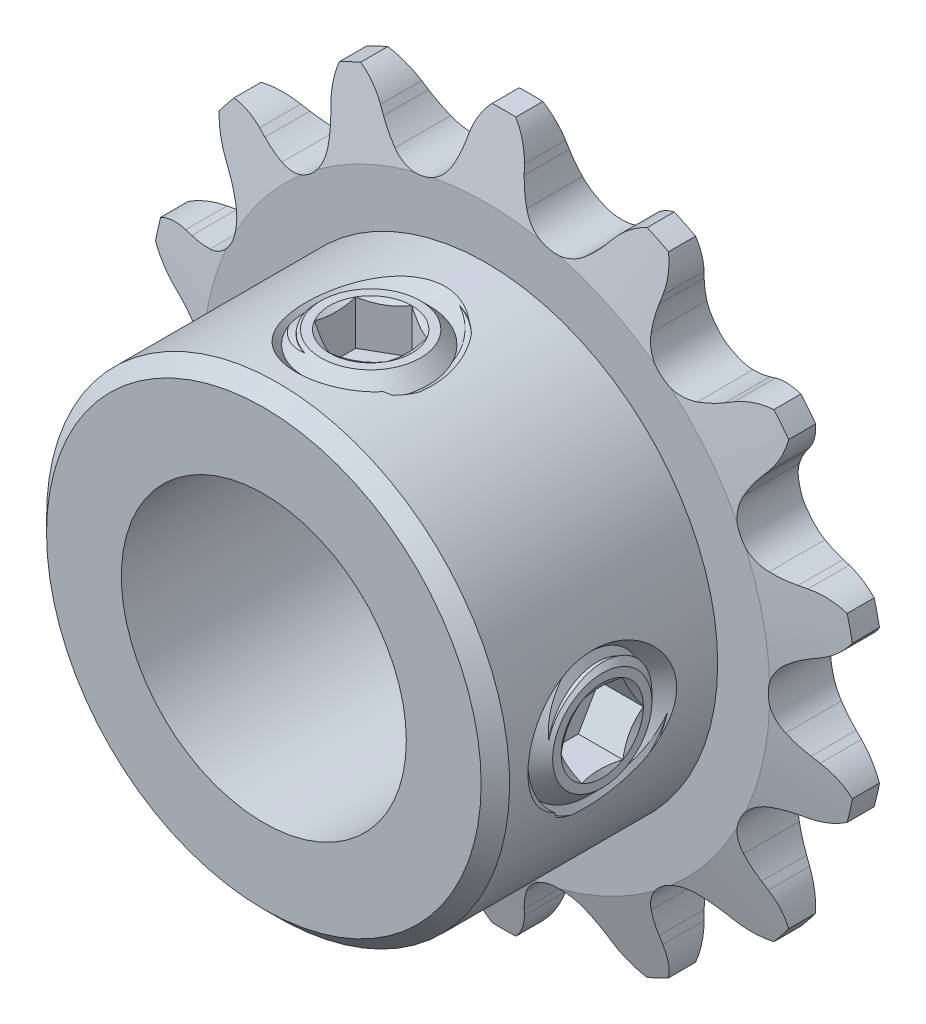
from build123d import *

# Parameters (mm, degrees)
CUT_EXTRUDE1_DEPTH      = 23.410198508
CIRPATTERN1_COUNT       = 14
BOSS_EXTRUDE1_START     = 1.397
SKETCH2_R               = 10.31875
BOSS_EXTRUDE1_DEPTH     = 9.906
CUT_EXTRUDE2_DEPTH      = 25.879893202
CUT_EXTRUDE2_DEPTH_BACK = 25.879893202
SKETCH3_OUTSIDE_W       = 42.278
SKETCH3_OUTSIDE_H       = 42.854
SKETCH3_OUTSIDE_R       = 15.875
SKETCH3_OUTSIDE_R_2     = 6.35
SKETCH4_W               = 1.74625
SKETCH4_H               = 5.461
CUT_EXTRUDE4_REACH      = 34.433
CUT_EXTRUDE4_END_RADIUS = 6.35
SKETCH6_R               = 2.38125
CUT_SWEEP1_PITCH        = 1.27
CIRPATTERN2_COUNT       = 2
CIRPATTERN2_ANGLE       = 90
CUT_SWEEP2_PITCH        = 1.27
CUT_EXTRUDE6_DEPTH      = 1.984375
CIRPATTERN3_COUNT       = 2
CIRPATTERN3_ANGLE       = 90


with BuildPart() as part:
    # Sketch1 → Revolve1 (revolve)
    with BuildSketch(Plane(origin=(0, 0, 0), x_dir=(0, 0, -1), z_dir=(1, 0, 0)), mode=Mode.PRIVATE) as revolve1_sk:
        Polygon((1.397, 0), (-1.397, 0), (-1.397, 12.640583899), (-0.60325, 15.815583899), (0.60325, 15.815583899), (1.397, 12.640583899), align=None)
    revolve(revolve1_sk.sketch.rotate(Axis((0, 0, -1.397), (0, 0, 1)), 90), axis=Axis((0, 0, -1.397), (0, 0, 1)))

    # Sketch0 → Cut-Extrude1 (cut, symmetric)
    with BuildSketch(Plane.XY):
        with BuildLine():
            Line((5.186129219, -13.596278832), (4.966335914, -13.31639744))
            ThreePointArc((4.966335914, -13.31639744), (4.614309016, -12.92049686), (4.216657928, -12.570448549))
            ThreePointArc((4.216657928, -12.570448549), (2.79730298, -12.255785133), (1.655035699, -13.155122107))
            ThreePointArc((1.655035699, -13.155122107), (1.448644719, -13.643039078), (1.303254266, -14.152471922))
            Line((1.303254266, -14.152471922), (1.226663327, -14.500001084))
            ThreePointArc((1.226663327, -14.500001084), (0.154762783, -16.131385383), (-1.73130393, -16.634513455))
            ThreePointArc((-1.73130393, -16.634513455), (3.721521762, -16.305052191), (8.777295839, -14.235994133))
            ThreePointArc((8.777295839, -14.235994133), (6.859709357, -14.601025081), (5.186129219, -13.596278832))
        make_face()
    cut_extrude1 = extrude(amount=CUT_EXTRUDE1_DEPTH, both=True, mode=Mode.SUBTRACT)

    # CirPattern1: Cut-Extrude1 ×14 about axis
    cirpattern1_axis = Axis((0, 0, 0), (0, 0, 1))
    for i in range(1, CIRPATTERN1_COUNT):
        add(cut_extrude1.rotate(cirpattern1_axis, i * 360 / CIRPATTERN1_COUNT), mode=Mode.SUBTRACT)

    # Sketch2 → Boss-Extrude1 (add)
    with BuildSketch(Plane.XY.offset(BOSS_EXTRUDE1_START)):
        Circle(SKETCH2_R)
    extrude(amount=BOSS_EXTRUDE1_DEPTH)

    # Sketch3 outside → Cut-Extrude2 (cut, two sides: drawn at the far end of the back side and taken through both)
    # profile 1 of 2: a face of its own
    with BuildSketch(Plane.XY.offset(-CUT_EXTRUDE2_DEPTH_BACK)):
        Rectangle(SKETCH3_OUTSIDE_W, SKETCH3_OUTSIDE_H)
        Circle(SKETCH3_OUTSIDE_R, mode=Mode.SUBTRACT)
    # profile 2 of 2: a face of its own
    with BuildSketch(Plane.XY.offset(-CUT_EXTRUDE2_DEPTH_BACK)):
        with Locations(Location((0, 0, 0), (0, 0, 180))):
            Circle(SKETCH3_OUTSIDE_R_2)
    extrude(amount=CUT_EXTRUDE2_DEPTH + CUT_EXTRUDE2_DEPTH_BACK, mode=Mode.SUBTRACT)

    # Sketch4 → Cut-Revolve1 (revolve, cut)
    with BuildSketch(Plane(origin=(0, 0, 0), x_dir=(0, 0, -1), z_dir=(1, 0, 0))):
        Polygon((-11.303, 10.31875), (-11.303, 9.68375), (-10.668, 10.31875), align=None)
        with Locations((-2.270125, 13.085083899)):
            Rectangle(SKETCH4_W, SKETCH4_H)
    revolve(axis=Axis((0, 0, -1.397), (0, 0, 1)), mode=Mode.SUBTRACT)

    # Cut-Extrude4: up to this cylinder (the profile starts outside it)
    cut_extrude4_end = Plane(origin=(0, 0, 6.5405), z_dir=(0, 0, -1)) * Cylinder(CUT_EXTRUDE4_END_RADIUS, 82.566, mode=Mode.PRIVATE)
    # Sketch6 → Cut-Extrude4 (cut, up to the surface)
    with BuildSketch(Plane(origin=(0, 10.31875, 0), x_dir=(-1, 0, 0), z_dir=(0, 1, 0)), mode=Mode.PRIVATE) as cut_extrude4_sk1:
        with Locations(Location((0, 6.5405, 0), (0, 0, 90))):
            Circle(SKETCH6_R)
    cut_extrude4_tool1 = extrude(cut_extrude4_sk1.sketch, amount=-CUT_EXTRUDE4_REACH, mode=Mode.PRIVATE) - cut_extrude4_end
    cut_extrude4 = cut_extrude4_tool1.solids().sort_by_distance((0, 10.31875, 6.5405))[0]
    add(cut_extrude4, mode=Mode.SUBTRACT)

    # Cut-Sweep1: arcs per turn and ends read off the stored shape
    # Cut-Sweep1: the profile of Sketch8 screwed along a right-hand helix through 10.125 turns, 8 arcs to a turn; built about Z, then put on its axis
    cut_sweep1_z = Axis((0, 0, 0), (0, 0, 1))
    cut_sweep1_corners = [(3.175, 0, -1.825625), (3.175, 0, -1.984375), (2.281370036, 0, -2.5003125), (2.281370036, 0, -1.3096875)]
    with BuildLine(mode=Mode.PRIVATE) as cut_sweep1_profile:
        Line(cut_sweep1_corners[0], cut_sweep1_corners[1])
        Line(cut_sweep1_corners[1], cut_sweep1_corners[2])
        Line(cut_sweep1_corners[2], cut_sweep1_corners[3])
        Line(cut_sweep1_corners[3], cut_sweep1_corners[0])
    cut_sweep1_cap = Face(cut_sweep1_profile.wire())
    cut_sweep1_turn_angles = [0, 22.5, 45, 67.5, 90, 112.5, 135, 157.5, 180, 202.5, 225, 247.5, 270, 292.5, 315, 337.5, 360]
    cut_sweep1_turn_weights = [1, 0.9238795325112867, 1, 0.9238795325112867, 1, 0.9238795325112867, 1, 0.9238795325112867, 1, 0.9238795325112867, 1, 0.9238795325112867, 1, 0.9238795325112867, 1, 0.9238795325112867, 1]
    cut_sweep1_turn_rails = [Edge.make_bspline([Vector(p[0], p[1], 0).rotate(cut_sweep1_z, cut_sweep1_turn_angles[k]) / cut_sweep1_turn_weights[k] + Vector(0, 0, p[2] + CUT_SWEEP1_PITCH * cut_sweep1_turn_angles[k] / 360) for k in range(17)], [0, 0, 0, 1, 1, 2, 2, 3, 3, 4, 4, 5, 5, 6, 6, 7, 7, 8, 8, 8], 2, cut_sweep1_turn_weights) for p in cut_sweep1_corners]
    cut_sweep1_turn_sides = [Face.make_surface_from_curves(cut_sweep1_turn_rails[p[0]], cut_sweep1_turn_rails[p[1]]) for p in [(0, 1), (1, 2), (2, 3), (3, 0)]]
    cut_sweep1_last_angles = [3600, 3622.5, 3645]
    cut_sweep1_last_weights = [1, 0.9238795325112867, 1]
    cut_sweep1_last_rails = [Edge.make_bspline([Vector(p[0], p[1], 0).rotate(cut_sweep1_z, cut_sweep1_last_angles[k]) / cut_sweep1_last_weights[k] + Vector(0, 0, p[2] + CUT_SWEEP1_PITCH * cut_sweep1_last_angles[k] / 360) for k in range(3)], [0, 0, 0, 1, 1, 1], 2, cut_sweep1_last_weights) for p in cut_sweep1_corners]
    cut_sweep1_last_sides = [Face.make_surface_from_curves(cut_sweep1_last_rails[p[0]], cut_sweep1_last_rails[p[1]]) for p in [(0, 1), (1, 2), (2, 3), (3, 0)]]
    cut_sweep1 = Plane(origin=(0, 10.31875, 6.5405), x_dir=(0, 0, 1), z_dir=(0, -1, 0)) * Solid(Shell([*[p.moved(Location((0, 0, CUT_SWEEP1_PITCH * i))) for i in range(10) for p in cut_sweep1_turn_sides], *cut_sweep1_last_sides, cut_sweep1_cap, cut_sweep1_cap.rotate(cut_sweep1_z, 3645).moved(Location((0, 0, CUT_SWEEP1_PITCH * 3645 / 360)))]))
    add(cut_sweep1, mode=Mode.SUBTRACT)

    # Cut-Extrude5: read off the stored shape, not the designer's step
    # Cut-Extrude5 outline → Cut-Extrude5 (revolve, cut)
    with BuildSketch(Plane.XY.offset(6.5405)):
        Polygon((2.381249302, 10.318750952), (2.381249302, 9.387517769), (3.312482485, 10.318750952), align=None)
    cut_extrude5 = revolve(axis=Axis((0, 0, 6.5405), (0, 1, 0)), mode=Mode.SUBTRACT)

    # CirPattern2: Cut-Extrude4, Cut-Sweep1, Cut-Extrude5 ×2 about axis
    cirpattern2_axis = Axis((0, 0, 11.303), (0, 0, -1))
    add([cut_extrude4.rotate(cirpattern2_axis, i * CIRPATTERN2_ANGLE / (CIRPATTERN2_COUNT - 1)) for i in range(1, CIRPATTERN2_COUNT)], mode=Mode.SUBTRACT)
    add([cut_sweep1.rotate(cirpattern2_axis, i * CIRPATTERN2_ANGLE / (CIRPATTERN2_COUNT - 1)) for i in range(1, CIRPATTERN2_COUNT)], mode=Mode.SUBTRACT)
    add([cut_extrude5.rotate(cirpattern2_axis, i * CIRPATTERN2_ANGLE / (CIRPATTERN2_COUNT - 1)) for i in range(1, CIRPATTERN2_COUNT)], mode=Mode.SUBTRACT)


with BuildPart() as body_2:
    # Sketch10 → Revolve2 (revolve)
    with BuildSketch(Plane(origin=(0, 0, 0), x_dir=(0, 0, -1), z_dir=(1, 0, 0))):
        Polygon((-6.5405, 10.31875), (-6.5405, 3.96875), (-8.75312927, 3.96875), (-9.7155, 4.93112073), (-9.7155, 9.35637927), (-8.75312927, 10.31875), align=None)
    revolve(axis=Axis((0, 10.31875, 6.5405), (0, -1, 0)))

    # Cut-Sweep2: arcs per turn and ends read off the stored shape
    # Cut-Sweep2: the profile of Sketch12 screwed along a right-hand helix through 6 turns, 8 arcs to a turn; built about Z, then put on its axis
    cut_sweep2_z = Axis((0, 0, 0), (0, 0, 1))
    cut_sweep2_corners = [(3.243740766, 0, -0.5953125), (3.243740766, 0, 0.5953125), (2.350110803, 0, 0.079375), (2.350110803, 0, -0.079375)]
    with BuildLine(mode=Mode.PRIVATE) as cut_sweep2_profile:
        Line(cut_sweep2_corners[0], cut_sweep2_corners[1])
        Line(cut_sweep2_corners[1], cut_sweep2_corners[2])
        Line(cut_sweep2_corners[2], cut_sweep2_corners[3])
        Line(cut_sweep2_corners[3], cut_sweep2_corners[0])
    cut_sweep2_cap = Face(cut_sweep2_profile.wire())
    cut_sweep2_turn_angles = [0, 22.5, 45, 67.5, 90, 112.5, 135, 157.5, 180, 202.5, 225, 247.5, 270, 292.5, 315, 337.5, 360]
    cut_sweep2_turn_weights = [1, 0.9238795325112867, 1, 0.9238795325112867, 1, 0.9238795325112867, 1, 0.9238795325112867, 1, 0.9238795325112867, 1, 0.9238795325112867, 1, 0.9238795325112867, 1, 0.9238795325112867, 1]
    cut_sweep2_turn_rails = [Edge.make_bspline([Vector(p[0], p[1], 0).rotate(cut_sweep2_z, cut_sweep2_turn_angles[k]) / cut_sweep2_turn_weights[k] + Vector(0, 0, p[2] + CUT_SWEEP2_PITCH * cut_sweep2_turn_angles[k] / 360) for k in range(17)], [0, 0, 0, 1, 1, 2, 2, 3, 3, 4, 4, 5, 5, 6, 6, 7, 7, 8, 8, 8], 2, cut_sweep2_turn_weights) for p in cut_sweep2_corners]
    cut_sweep2_turn_sides = [Face.make_surface_from_curves(cut_sweep2_turn_rails[p[0]], cut_sweep2_turn_rails[p[1]]) for p in [(0, 1), (1, 2), (2, 3), (3, 0)]]
    cut_sweep2 = Plane(origin=(0, 10.31875, 6.5405), x_dir=(0, 0, 1), z_dir=(0, -1, 0)) * Solid(Shell([*[p.moved(Location((0, 0, CUT_SWEEP2_PITCH * i))) for i in range(6) for p in cut_sweep2_turn_sides], cut_sweep2_cap, cut_sweep2_cap.rotate(cut_sweep2_z, 2160).moved(Location((0, 0, CUT_SWEEP2_PITCH * 2160 / 360)))]))
    add(cut_sweep2, mode=Mode.SUBTRACT)

    # Sketch13 → Cut-Extrude6 (cut)
    with BuildSketch(Plane(origin=(0, 10.31875, 0), x_dir=(1, 0, 0), z_dir=(0, 1, 0))):
        Polygon((0, -4.707412895), (-1.5875, -5.623956448), (-1.5875, -7.457043552), (0, -8.373587105), (1.5875, -7.457043552), (1.5875, -5.623956448), align=None)
    extrude(amount=-CUT_EXTRUDE6_DEPTH, mode=Mode.SUBTRACT)

    # Cut-Extrude7 cone 1 section (through the dimple's axis) → Cut-Extrude7 (revolve, cut)
    with BuildSketch(Plane(origin=(0, 10.31875, 6.5405), x_dir=(0, 0, 1), z_dir=(1, 0, 0))):
        Polygon((0, 0), (1.833087105, 0), (0, 1.058333333), align=None)
    revolve(axis=Axis((0, 10.31875, 6.5405), (0, -1, 0)), mode=Mode.SUBTRACT)


with BuildPart() as cirpattern3_1:
    # CirPattern3: pattern copy
    add(body_2.part.rotate(Axis((0, 0, 11.303), (0, 0, -1)), 1 * CIRPATTERN3_ANGLE / (CIRPATTERN3_COUNT - 1)))


solid = Compound([part.part, body_2.part, cirpattern3_1.part])
